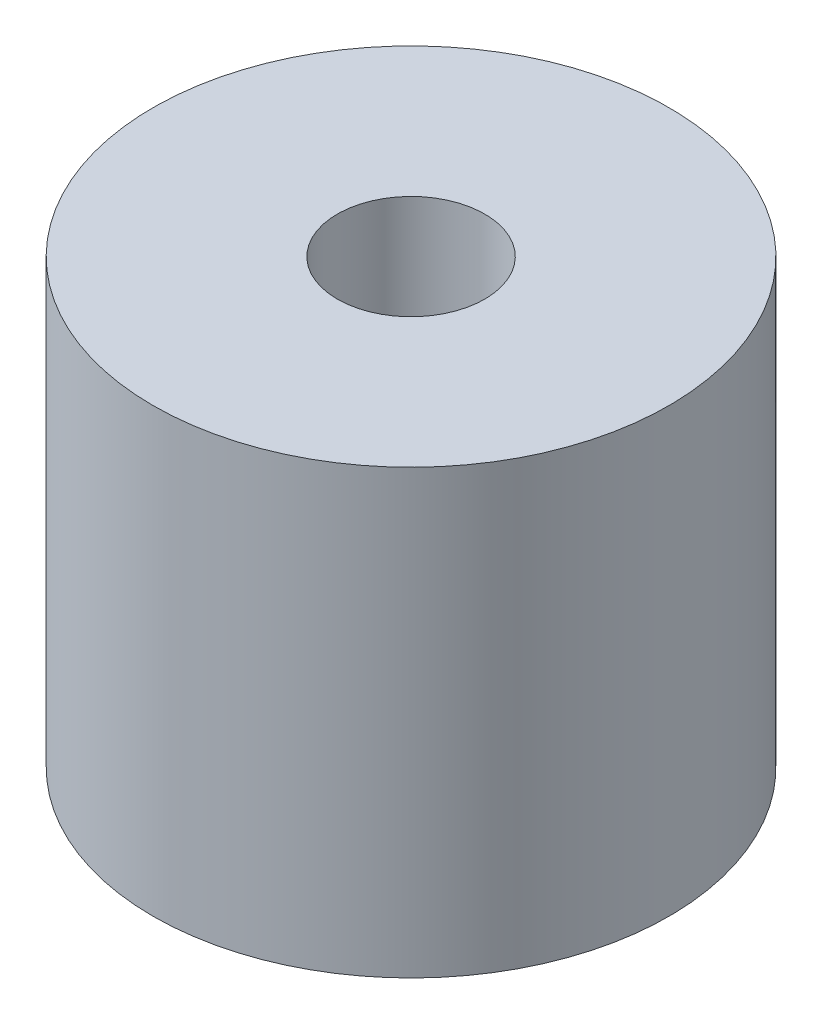
from build123d import *

# Parameters (mm, degrees)
IZIM1_R                     = 17.5
IZIM1_R_2                   = 17
Y_KSEKLIK_EKSTR_ZYON1_DEPTH = 25
KAL_NLA_T_R2_START          = 20
KAL_NLA_T_R2_OUTLINE_R      = 17.5
KAL_NLA_T_R2_DEPTH          = 10
IZIM5_R                     = 5
KES_EKSTR_ZYON4_DEPTH       = 25


# Read off the part's stored shape, not the designer's step: Kalınlaştır2
with BuildPart() as part:
    # Çizim1 → Yükseklik-Ekstrüzyon1 (new body)
    with BuildSketch(Plane(origin=(0, 0, 0), x_dir=(1, 0, 0), z_dir=(0, 1, 0))):
        with Locations(Location((0, 0, 0), (0, 0, 270))):
            Circle(IZIM1_R)
        with Locations(Location((0, 0, 0), (0, 0, 270))):
            Circle(IZIM1_R_2, mode=Mode.SUBTRACT)
    extrude(amount=Y_KSEKLIK_EKSTR_ZYON1_DEPTH)

    # Kalınlaştır2 outline → Kalınlaştır2 (add)
    with BuildSketch(Plane(origin=(0, 0, 0), x_dir=(1, 0, 0), z_dir=(0, 1, 0)).offset(KAL_NLA_T_R2_START)):
        Circle(KAL_NLA_T_R2_OUTLINE_R)
    extrude(amount=KAL_NLA_T_R2_DEPTH)

    # Çizim5 → Kes-Ekstrüzyon4 (cut)
    with BuildSketch(Plane(origin=(0, 30, 0), x_dir=(1, 0, 0), z_dir=(0, 1, 0))):
        with Locations(Location((0, 0, 0), (0, 0, 270))):
            Circle(IZIM5_R)
    extrude(amount=-KES_EKSTR_ZYON4_DEPTH, mode=Mode.SUBTRACT)


solid = part.part
